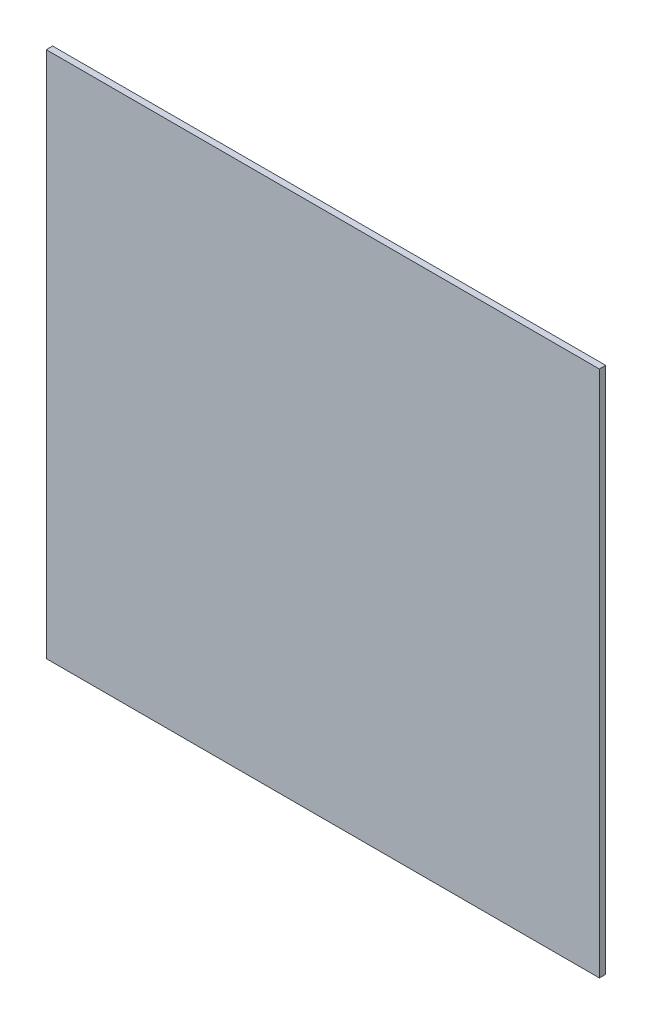
from build123d import *

# Parameters (mm, degrees)
SKETCH_1_W      = 524
SKETCH_1_H      = 499.6
EXTRUDE_1_DEPTH = 6


with BuildPart() as part:
    # Эскиз1 → Бобышка-Вытянуть1 (new body)
    with BuildSketch(Plane.XY):
        with Locations((-262, -243.8)):
            Rectangle(SKETCH_1_W, SKETCH_1_H)
    extrude(amount=-EXTRUDE_1_DEPTH)


solid = part.part
